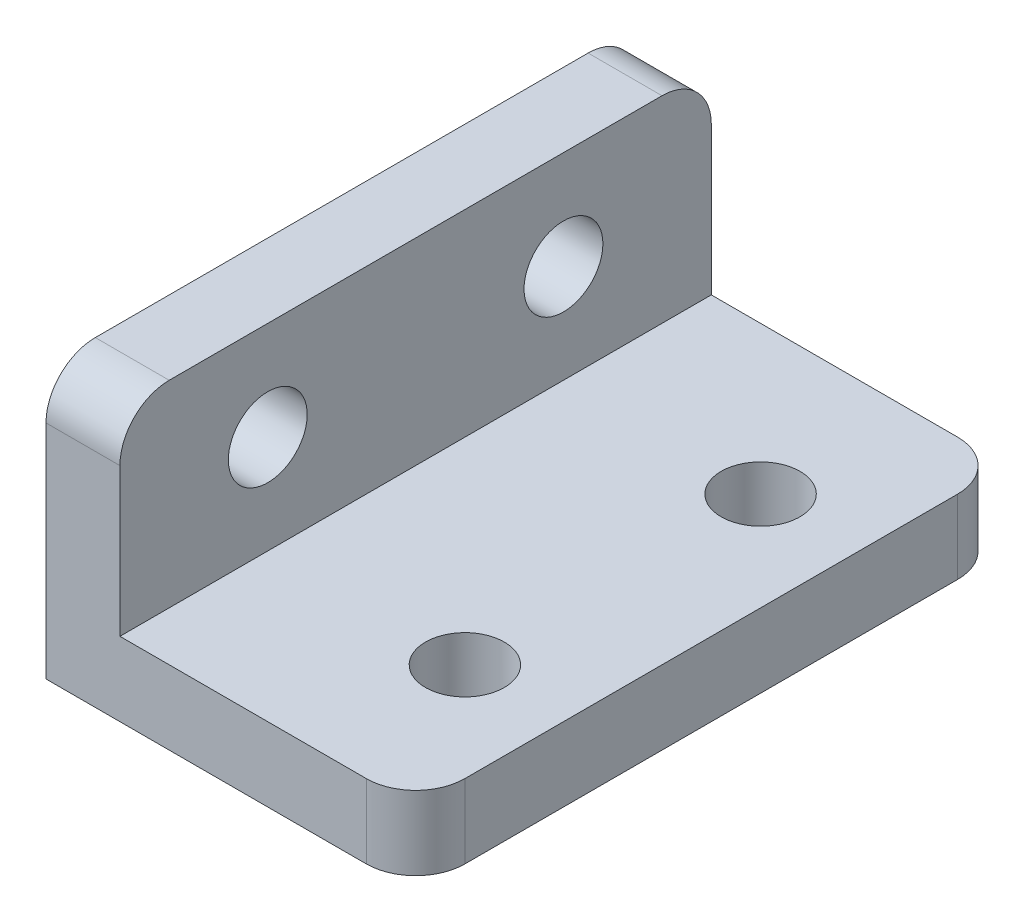
from build123d import *

# Parameters (mm, degrees)
EXTRUDE_1_DEPTH     = 24
SKETCH_2_R          = 1.6
CUT_EXTRUDE_1_DEPTH = 24
SKETCH_3_R          = 1.6
CUT_EXTRUDE_2_DEPTH = 24
FILLET_1_R          = 2


with BuildPart() as part:
    # 草图1 → 凸台-拉伸1 (new body)
    with BuildSketch(Plane.XY):
        Polygon((6, 112.691622655), (3, 112.691622655), (3, 101.691622655), (18, 101.691622655), (18, 104.691622655), (6, 104.691622655), align=None)
    extrude(amount=-EXTRUDE_1_DEPTH)

    # 草图2 → 切除-拉伸1 (cut)
    with BuildSketch(Plane(origin=(6, 0, 0), x_dir=(0, 0, -1), z_dir=(1, 0, 0))):
        with Locations((6, 108.691622655)):
            Circle(SKETCH_2_R)
        with Locations((18, 108.691622655)):
            Circle(SKETCH_2_R)
    extrude(amount=-CUT_EXTRUDE_1_DEPTH, mode=Mode.SUBTRACT)

    # 草图3 → 切除-拉伸2 (cut)
    with BuildSketch(Plane(origin=(0, 104.691622655, 0), x_dir=(1, 0, 0), z_dir=(0, 1, 0))):
        with Locations((14, 6)):
            Circle(SKETCH_3_R)
        with Locations((14, 18)):
            Circle(SKETCH_3_R)
    extrude(amount=-CUT_EXTRUDE_2_DEPTH, mode=Mode.SUBTRACT)

    # 圆角1
    fillet_1_edges = [part.edges().sort_by_distance(p)[0] for p in [
        (18, 103.191622655, -24),
        (18, 103.191622655, 0),
        (4.5, 112.691622655, -24),
        (4.5, 112.691622655, 0),
    ]]
    fillet(fillet_1_edges, radius=FILLET_1_R)


solid = part.part
